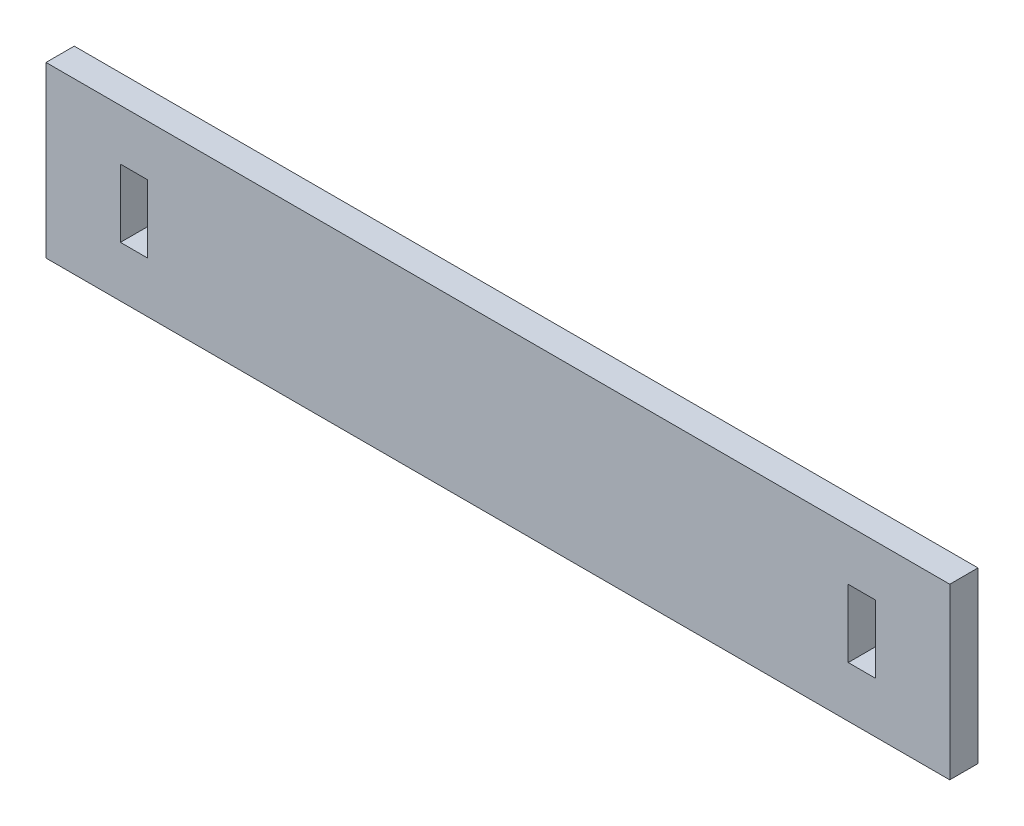
from build123d import *

# Parameters (mm, degrees)
SKETCH1_W           = 101.6
SKETCH1_H           = 19.05
BOSS_EXTRUDE1_DEPTH = 3.175
SKETCH2_W           = 3.048
SKETCH2_H           = 7.62
CUT_EXTRUDE1_DEPTH  = 104.419258966


with BuildPart() as part:
    # Sketch1 → Boss-Extrude1 (new body)
    with BuildSketch(Plane.XY):
        with Locations((50.8, 9.525)):
            Rectangle(SKETCH1_W, SKETCH1_H)
    extrude(amount=BOSS_EXTRUDE1_DEPTH)

    # Sketch2 → Cut-Extrude1 (cut, through all)
    with BuildSketch(Plane.XY.offset(3.175)):
        with Locations((9.892117884, 9.525)):
            Rectangle(SKETCH2_W, SKETCH2_H)
        with Locations((91.707882116, 9.525)):
            Rectangle(SKETCH2_W, SKETCH2_H)
    extrude(amount=-CUT_EXTRUDE1_DEPTH, mode=Mode.SUBTRACT)


solid = part.part
